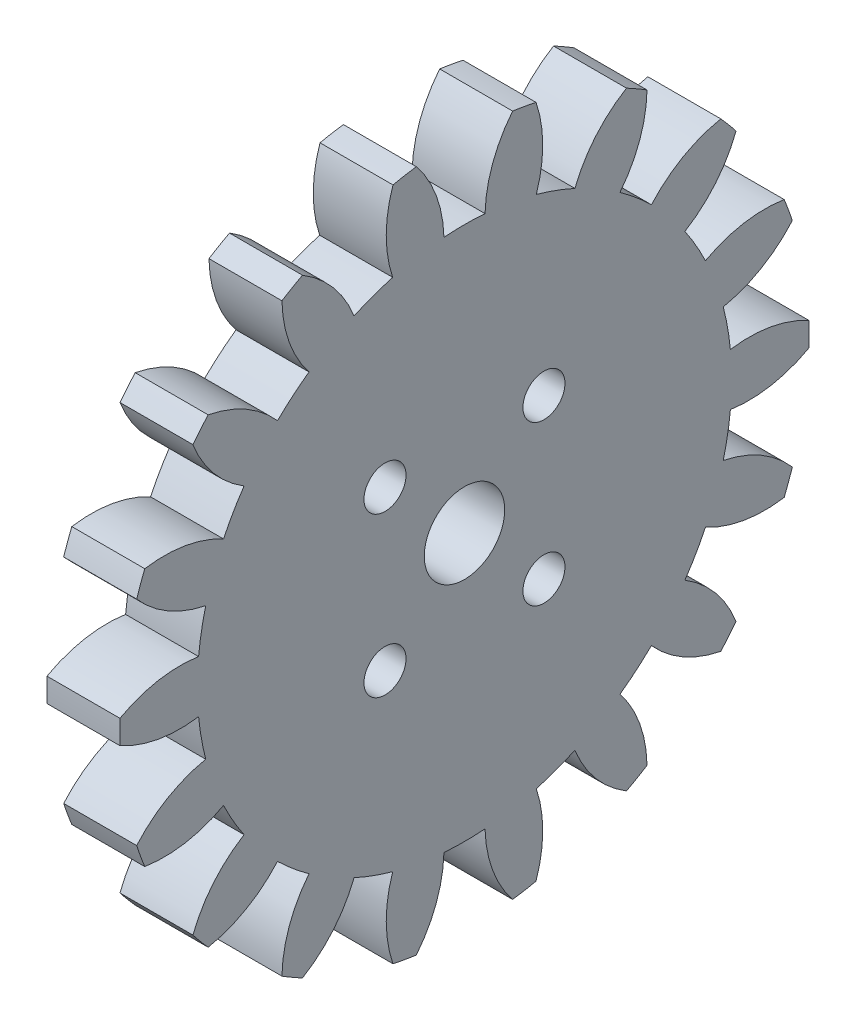
from build123d import *

# Parameters (mm, degrees)
BASPROSKE_W                  = 6.35
BASPROSKE_H                  = 30
TOOTHCUT_DEPTH               = 43.898980174
TEETHCUTS_COUNT              = 18
TEETHCUTS_ANGLE              = 340
BORSKE_R                     = 3.5
BORE_DEPTH                   = 50.0000508
ENL_V_MAT_EXTRU_1_REACH      = 44.694
ESQUISSE1_R                  = 1.83
R_P_TITION_CIRCULAIRE1_COUNT = 4


with BuildPart() as part:
    # BasProSke → Base-Revolve (revolve)
    with BuildSketch(Plane(origin=(0, 0, 0), x_dir=(1, 0, 0), z_dir=(0, 1, 0))):
        with Locations((3.175, 15)):
            Rectangle(BASPROSKE_W, BASPROSKE_H)
    revolve(axis=Axis((-10, 0, 0), (1, 0, 0)))

    # TooCutSke → ToothCut (cut, through all)
    with BuildSketch(Plane(origin=(0, 0, 0), x_dir=(0, 0, -1), z_dir=(1, 0, 0))):
        with BuildLine():
            ThreePointArc((1.787960056, 23.180146674), (0, 23.249), (-1.787960056, 23.180146674))
            ThreePointArc((-1.787960056, 23.180146674), (-2.454446843, 26.655567009), (-4.20853261, 29.728990875))
            ThreePointArc((-4.20853261, 29.728990875), (0, 30.0254), (4.20853261, 29.728990875))
            ThreePointArc((4.20853261, 29.728990875), (2.454446843, 26.655567009), (1.787960056, 23.180146674))
        make_face()
    toothcut = extrude(amount=TOOTHCUT_DEPTH, mode=Mode.SUBTRACT)

    # TeethCuts: ToothCut ×18 about axis
    teethcuts_axis = Axis((-10, 0, 0), (1, 0, 0))
    for i in range(1, TEETHCUTS_COUNT):
        add(toothcut.rotate(teethcuts_axis, i * TEETHCUTS_ANGLE / (TEETHCUTS_COUNT - 1)), mode=Mode.SUBTRACT)

    # BorSke → Bore (cut, symmetric)
    with BuildSketch(Plane(origin=(0, 0, 0), x_dir=(0, 0, -1), z_dir=(1, 0, 0))):
        Circle(BORSKE_R)
    extrude(amount=BORE_DEPTH, both=True, mode=Mode.SUBTRACT)

    # Esquisse1 → Enlèv. mat.-Extru.1 (cut, up to next)
    with BuildSketch(Plane.ZY, mode=Mode.PRIVATE) as enl_v_mat_extru_1_sk1:
        with Locations((-6.914797213, 6.914797213)):
            Circle(ESQUISSE1_R)
    enl_v_mat_extru_1_tool1 = extrude(enl_v_mat_extru_1_sk1.sketch, amount=-ENL_V_MAT_EXTRU_1_REACH, mode=Mode.PRIVATE) & part.part
    enl_v_mat_extru_1 = enl_v_mat_extru_1_tool1.solids().sort_by_distance((0, 6.914797, -6.914797))[0]
    add(enl_v_mat_extru_1, mode=Mode.SUBTRACT)

    # Répétition circulaire1: Enlèv. mat.-Extru.1 ×4 about axis
    r_p_tition_circulaire1_axis = Axis((0, 0, 0), (-1, 0, 0))
    for i in range(1, R_P_TITION_CIRCULAIRE1_COUNT):
        add(enl_v_mat_extru_1.rotate(r_p_tition_circulaire1_axis, i * 360 / R_P_TITION_CIRCULAIRE1_COUNT), mode=Mode.SUBTRACT)


solid = part.part
